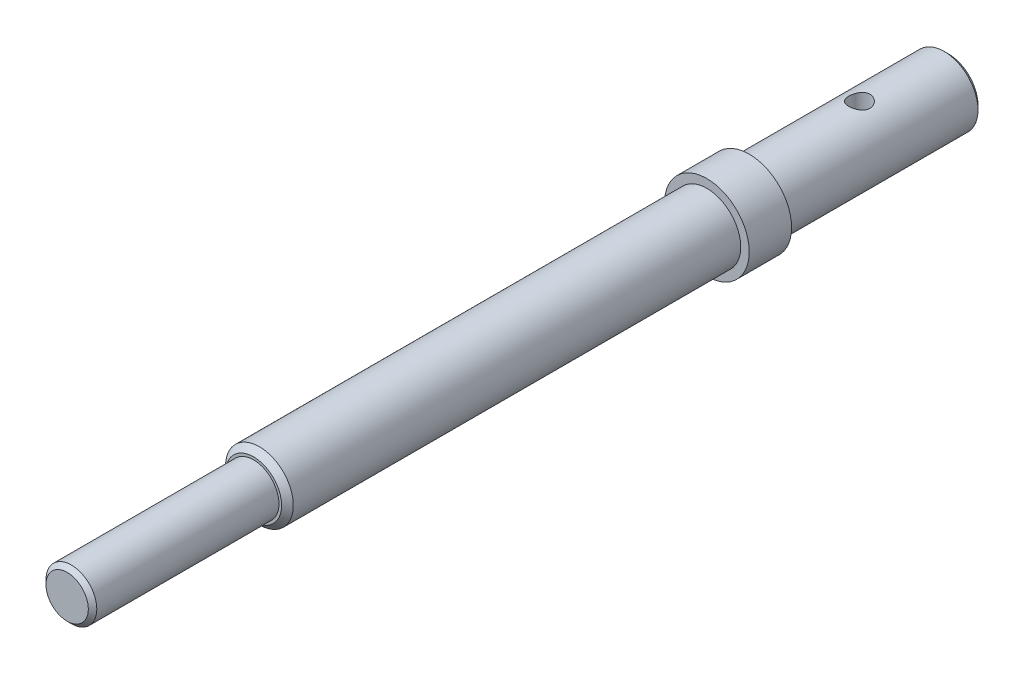
from build123d import *

# Parameters (mm, degrees)
CROQUIS1_R              = 4
SALIENTE_EXTRUIR1_DEPTH = 52
CROQUIS2_R              = 5
SALIENTE_EXTRUIR2_DEPTH = 5
CROQUIS3_R              = 4
CROQUIS3_R_2            = 3
CORTAR_EXTRUIR1_DEPTH   = 22
CROQUIS5_R              = 1.25
CORTAR_EXTRUIR2_DEPTH   = 54.009433123
CHAFL_N1_SIZE           = 0.5


# Read off the part's stored shape, not the designer's step: M8 Roscas Standard Taladro1
with BuildPart() as part:
    # Croquis1 → Saliente-Extruir1 (new, symmetric)
    with BuildSketch(Plane.XY):
        with Locations(Location((0, 0, 0), (0, 0, 180))):
            Circle(CROQUIS1_R)
    extrude(amount=SALIENTE_EXTRUIR1_DEPTH, both=True)

    # Croquis2 → Saliente-Extruir2 (add)
    with BuildSketch(Plane.XY.offset(-28.5)):
        Circle(CROQUIS2_R)
    extrude(amount=SALIENTE_EXTRUIR2_DEPTH)

    # Croquis3 → Cortar-Extruir1 (cut)
    with BuildSketch(Plane.XY.offset(52)):
        with Locations(Location((0, 0, 0), (0, 0, 180))):
            Circle(CROQUIS3_R)
        Circle(CROQUIS3_R_2, mode=Mode.SUBTRACT)
    extrude(amount=-CORTAR_EXTRUIR1_DEPTH, mode=Mode.SUBTRACT)

    # M8 Roscas Standard Taladro1 outline → M8 Roscas Standard Taladro1 (revolve, cut)
    with BuildSketch(Plane.XZ):
        Polygon((4, 30), (3.3095, 30), (4, 29.3095), align=None)
    revolve(axis=Axis((0, 0, 0), (0, 0, 1)), mode=Mode.SUBTRACT)

    # Croquis5 → Cortar-Extruir2 (cut, through all)
    with BuildSketch(Plane(origin=(0, 4, 0), x_dir=(1, 0, 0), z_dir=(0, 1, 0))):
        with Locations(Location((0, 41.5, 0), (0, 0, 270))):
            Circle(CROQUIS5_R)
    extrude(amount=-CORTAR_EXTRUIR2_DEPTH, mode=Mode.SUBTRACT)

    # Chaflán1
    chafl_n1_edges = [part.edges().sort_by_distance(p)[0] for p in [
        (-3, 0, 52),
        (4, 0, -52),
    ]]
    chamfer(chafl_n1_edges, length=CHAFL_N1_SIZE)


solid = part.part
